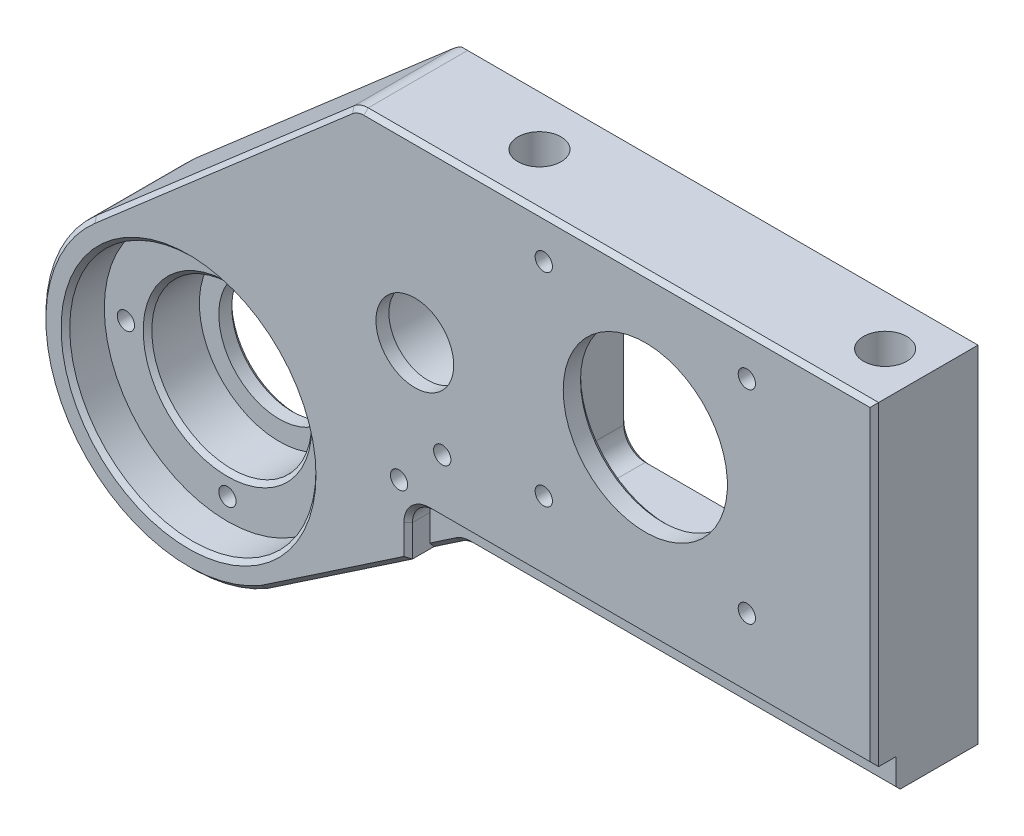
from build123d import *

# Parameters (mm, degrees)
EXTRUDE_1_DEPTH              = 25
SKETCH_2_W                   = 58
SKETCH_2_H                   = 58
CUT_EXTRUDE_1_DEPTH          = 20
SKETCH_3_R                   = 19
CUT_EXTRUDE_2_DEPTH          = 164.910721295
HOLE_WIZARD_M4_1_D           = 3.3
HOLE_WIZARD_M4_1_DEPTH       = 10.1
HOLE_WIZARD_M4_1_CBORE_D     = 4
HOLE_WIZARD_M4_1_CBORE_DEPTH = 8
HOLE_WIZARD_M4_1_TIP         = 0.991420021
CUT_EXTRUDE_3_DEPTH          = 5
SKETCH_10_R                  = 14
CUT_EXTRUDE_7_DEPTH          = 165.595639539
SKETCH_11_R                  = 18.5
CUT_EXTRUDE_8_DEPTH          = 21
SKETCH_12_R                  = 28.5
CUT_EXTRUDE_9_DEPTH          = 9
M10X1_25_1_D                 = 8.8
M10X1_25_1_DEPTH             = 33.75
M10X1_25_1_CBORE_D           = 10
M10X1_25_1_CBORE_DEPTH       = 30
M10X1_25_1_TIP               = 2.643786724
HOLE_WIZARD_M4_2_D           = 3.3
HOLE_WIZARD_M4_2_DEPTH       = 10.1
HOLE_WIZARD_M4_2_CBORE_D     = 4
HOLE_WIZARD_M4_2_CBORE_DEPTH = 8
HOLE_WIZARD_M4_2_TIP         = 0.991420021
M10X1_25_2_D                 = 8.8
M10X1_25_2_DEPTH             = 23.75
M10X1_25_2_CBORE_D           = 10
M10X1_25_2_CBORE_DEPTH       = 20
M10X1_25_2_TIP               = 2.643786724
HOLE_WIZARD_M4_3_D           = 3.3
HOLE_WIZARD_M4_3_DEPTH       = 10.1
HOLE_WIZARD_M4_3_CBORE_D     = 4
HOLE_WIZARD_M4_3_CBORE_DEPTH = 8
HOLE_WIZARD_M4_3_TIP         = 0.991420021
FILLET_1_R                   = 5
FILLET_2_R                   = 5
FILLET_3_R                   = 5
CHAMFER_1_SIZE               = 1
CHAMFER_2_SIZE               = 1
CHAMFER_3_SIZE               = 1
FILLET_5_R                   = 5
FILLET_7_R                   = 5
CHAMFER_4_SIZE               = 1
CHAMFER_5_SIZE               = 1
CHAMFER_6_SIZE               = 1
CHAMFER_7_SIZE               = 1
CHAMFER_8_SIZE               = 1
HOLE_WIZARD_M3_1_D           = 2.5
HOLE_WIZARD_M3_1_DEPTH       = 7.5
HOLE_WIZARD_M3_1_CBORE_D     = 3
HOLE_WIZARD_M3_1_CBORE_DEPTH = 6
HOLE_WIZARD_M3_1_TIP         = 0.751075774
SKETCH_27_R                  = 1.05
CUT_EXTRUDE_10_DEPTH         = 5
SKETCH_28_R                  = 9
CUT_EXTRUDE_11_DEPTH         = 165.595639539
SKETCH_30_R                  = 12.01
CUT_EXTRUDE_12_DEPTH         = 22
CUT_EXTRUDE_13_DEPTH         = 6
FILLET_8_R                   = 6
FILLET_9_R                   = 6
FILLET_10_R                  = 6
FILLET_11_R                  = 6
HOLE_WIZARD_M3_2_D           = 2.5
HOLE_WIZARD_M3_2_DEPTH       = 7.5
HOLE_WIZARD_M3_2_CBORE_D     = 3
HOLE_WIZARD_M3_2_CBORE_DEPTH = 6
HOLE_WIZARD_M3_2_TIP         = 0.751075774
SKETCH_34_W                  = 110.999205056
SKETCH_34_H                  = 23.357770551
CUT_EXTRUDE_14_DEPTH         = 1
HOLE_WIZARD_M4_4_D           = 3.3
HOLE_WIZARD_M4_4_DEPTH       = 10.1
HOLE_WIZARD_M4_4_CBORE_D     = 4
HOLE_WIZARD_M4_4_CBORE_DEPTH = 8
HOLE_WIZARD_M4_4_TIP         = 0.991420021


# Some blends are built 0.0001 mm under size
with BuildPart() as part:
    # 草图1 → 拉伸1 (new body)
    with BuildSketch(Plane.XY):
        with BuildLine():
            Line((110.103016241, 97.672563805), (10.103016241, 97.672563805))
            Line((10.103016241, 97.672563805), (-50.926931526, 44.657993575))
            ThreePointArc((-50.926931526, 44.657993575), (-56.221019531, -0.904930399), (-11.32784203, -10.318220087))
            Line((-11.32784203, -10.318220087), (30.103016241, 17.672563805))
            Line((30.103016241, 17.672563805), (110.103016241, 17.672563805))
            Line((110.103016241, 17.672563805), (130.103016241, 17.672563805))
            Line((130.103016241, 17.672563805), (130.103016241, 97.672563805))
            Line((130.103016241, 97.672563805), (110.103016241, 97.672563805))
        make_face()
    extrude(amount=EXTRUDE_1_DEPTH)

    # 草图2 → 切除-拉伸1 (cut)
    with BuildSketch(Plane(origin=(0, 0, 0), x_dir=(-1, 0, 0), z_dir=(0, 0, -1))):
        with Locations((-77.103016241, 64.672563805)):
            Rectangle(SKETCH_2_W, SKETCH_2_H)
    extrude(amount=-CUT_EXTRUDE_1_DEPTH, mode=Mode.SUBTRACT)

    # 草图3 → 切除-拉伸2 (cut, through all)
    with BuildSketch(Plane(origin=(0, 0, 20), x_dir=(-1, 0, 0), z_dir=(0, 0, -1))):
        with Locations((-77.103016241, 64.672563805)):
            Circle(SKETCH_3_R)
    extrude(amount=-CUT_EXTRUDE_2_DEPTH, mode=Mode.SUBTRACT)

    # M4 螺纹孔1
    with Locations(Plane(origin=(100.603016241, 88.172563805, 20), x_dir=(-1, 0, 0), z_dir=(0, 0, -1))):
        with Locations((0, 0), (47, 0), (0, -47), (47, -47)):
            CounterBoreHole(HOLE_WIZARD_M4_1_D / 2, HOLE_WIZARD_M4_1_CBORE_D / 2, HOLE_WIZARD_M4_1_CBORE_DEPTH, depth=HOLE_WIZARD_M4_1_DEPTH)
            with Locations((0, 0, -(HOLE_WIZARD_M4_1_DEPTH + HOLE_WIZARD_M4_1_TIP / 2))):  # 118° drill point
                Cone(0, HOLE_WIZARD_M4_1_D / 2, HOLE_WIZARD_M4_1_TIP, mode=Mode.SUBTRACT)

    # 草图6 → 切除-拉伸3 (cut)
    with BuildSketch(Plane.XY.offset(25)):
        Polygon((30.103016241, 24.672563805), (22.214984728, 24.672563805), (22.214984728, 12.343391429), (30.103016241, 17.672563805), (130.103016241, 17.672563805), (130.103016241, 24.672563805), align=None)
    extrude(amount=-CUT_EXTRUDE_3_DEPTH, mode=Mode.SUBTRACT)

    # 草图10 → 切除-拉伸7 (cut, through all)
    with BuildSketch(Plane.XY.offset(25)):
        with Locations((-28.61867045, 18.976902465)):
            Circle(SKETCH_10_R)
    extrude(amount=-CUT_EXTRUDE_7_DEPTH, mode=Mode.SUBTRACT)

    # 草图11 → 切除-拉伸8 (cut)
    with BuildSketch(Plane.XY.offset(25)):
        with Locations((-28.61867045, 18.976902465)):
            Circle(SKETCH_11_R)
    extrude(amount=-CUT_EXTRUDE_8_DEPTH, mode=Mode.SUBTRACT)

    # 草图12 → 切除-拉伸9 (cut)
    with BuildSketch(Plane.XY.offset(25)):
        with Locations((-28.61867045, 18.976902465)):
            Circle(SKETCH_12_R)
    extrude(amount=-CUT_EXTRUDE_9_DEPTH, mode=Mode.SUBTRACT)

    # M10x1.25 螺纹孔1
    with Locations(Plane.XZ.offset(-17.672563805)):
        with Locations((120.103016241, 10), (40.103016241, 10)):
            CounterBoreHole(M10X1_25_1_D / 2, M10X1_25_1_CBORE_D / 2, M10X1_25_1_CBORE_DEPTH, depth=M10X1_25_1_DEPTH)
            with Locations((0, 0, -(M10X1_25_1_DEPTH + M10X1_25_1_TIP / 2))):  # 118° drill point
                Cone(0, M10X1_25_1_D / 2, M10X1_25_1_TIP, mode=Mode.SUBTRACT)

    # M4 螺纹孔2
    with Locations(Plane.XY.offset(16)):
        with Locations((-28.61867045, 42.476902465), (-52.11892229, 18.976902465), (-5.11867045, 18.976902465), (-28.61867045, -4.523097535)):
            CounterBoreHole(HOLE_WIZARD_M4_2_D / 2, HOLE_WIZARD_M4_2_CBORE_D / 2, HOLE_WIZARD_M4_2_CBORE_DEPTH, depth=HOLE_WIZARD_M4_2_DEPTH)
            with Locations((0, 0, -(HOLE_WIZARD_M4_2_DEPTH + HOLE_WIZARD_M4_2_TIP / 2))):  # 118° drill point
                Cone(0, HOLE_WIZARD_M4_2_D / 2, HOLE_WIZARD_M4_2_TIP, mode=Mode.SUBTRACT)

    # M10x1.25 螺纹孔2
    with Locations(Plane(origin=(0, 97.672563805, 0), x_dir=(-1, 0, 0), z_dir=(0, 1, 0))):
        with Locations((-40.103016241, 12.5), (-120.103016241, 12.5)):
            CounterBoreHole(M10X1_25_2_D / 2, M10X1_25_2_CBORE_D / 2, M10X1_25_2_CBORE_DEPTH, depth=M10X1_25_2_DEPTH)
            with Locations((0, 0, -(M10X1_25_2_DEPTH + M10X1_25_2_TIP / 2))):  # 118° drill point
                Cone(0, M10X1_25_2_D / 2, M10X1_25_2_TIP, mode=Mode.SUBTRACT)

    # M4 螺纹孔3
    with Locations(Plane.XY.offset(25)):
        with Locations((30.103016241, 37.672563805), (20.103016241, 27.672563805)):
            CounterBoreHole(HOLE_WIZARD_M4_3_D / 2, HOLE_WIZARD_M4_3_CBORE_D / 2, HOLE_WIZARD_M4_3_CBORE_DEPTH, depth=HOLE_WIZARD_M4_3_DEPTH)
            with Locations((0, 0, -(HOLE_WIZARD_M4_3_DEPTH + HOLE_WIZARD_M4_3_TIP / 2))):  # 118° drill point
                Cone(0, HOLE_WIZARD_M4_3_D / 2, HOLE_WIZARD_M4_3_TIP, mode=Mode.SUBTRACT)

    # 圆角1
    fillet_1_edges = [part.edges().sort_by_distance(p)[0] for p in [
        (48.103016241, 35.672563805, 10),
    ]]
    fillet(fillet_1_edges, radius=FILLET_1_R)

    # 圆角2
    fillet_2_edges = [part.edges().sort_by_distance(p)[0] for p in [
        (106.103016241, 35.672563805, 10),
        (106.103016241, 93.672563805, 10),
        (48.103016241, 93.672563805, 10),
    ]]
    fillet(fillet_2_edges, radius=FILLET_2_R)

    # 圆角3
    fillet_3_edges = [part.edges().sort_by_distance(p)[0] for p in [
        (22.214984728, 24.672563805, 22.5),
    ]]
    fillet(fillet_3_edges, radius=FILLET_3_R)

    # 倒角1
    chamfer_1_edges = [part.edges().sort_by_distance(p)[0] for p in [
        (96.103016241, 64.672563805, 20),
    ]]
    chamfer(chamfer_1_edges, length=CHAMFER_1_SIZE)

    # 倒角2
    # the kernel refuses this chamfer: 1 mm, written as the material it takes off along each edge
    with BuildSketch(Plane(origin=(-28.61867045, 18.976902465, 16), x_dir=(1, 0, 0), z_dir=(0, -1, 0))) as chamfer_2_piece_1:
        Polygon((18.5 + CHAMFER_2_SIZE, 0), (18.5, -CHAMFER_2_SIZE), (18.5, 0), align=None)
    revolve(axis=Axis((-28.61867045, 18.976902465, 16), (0, 0, 1)), mode=Mode.SUBTRACT)
    with BuildSketch(Plane(origin=(48.103016241, 88.672563805, 0), x_dir=(0, 0, 1), z_dir=(0, -1, 0)), Plane(origin=(101.103016241, 93.672563805, 0), x_dir=(0, 0, 1), z_dir=(-1, 0, 0)), Plane(origin=(53.103016241, 35.672563805, 0), x_dir=(0, 0, 1), z_dir=(1, 0, 0)), Plane(origin=(106.103016241, 40.672563805, 0), x_dir=(0, 0, 1), z_dir=(0, 1, 0))) as chamfer_2_piece_2:
        Polygon((CHAMFER_2_SIZE, 0), (0, CHAMFER_2_SIZE), (0, 0), align=None)
    extrude(amount=48, mode=Mode.SUBTRACT)
    with BuildSketch(Plane(origin=(53.103016241, 40.672563805, 0), x_dir=(-1, 0, 0), z_dir=(0, 1, 0))) as chamfer_2_piece_3:
        Polygon((5, CHAMFER_2_SIZE), (5 + CHAMFER_2_SIZE, 0), (5, 0), align=None)
    revolve(axis=Axis((53.103016241, 40.672563805, 0), (0, 0, 1)), revolution_arc=90, mode=Mode.SUBTRACT)
    with BuildSketch(Plane(origin=(53.103016241, 88.672563805, 0), x_dir=(-1, 0, 0), z_dir=(0, -1, 0))) as chamfer_2_piece_4:
        Polygon((5, -CHAMFER_2_SIZE), (5 + CHAMFER_2_SIZE, 0), (5, 0), align=None)
    revolve(axis=Axis((53.103016241, 88.672563805, 0), (0, 0, -1)), revolution_arc=90, mode=Mode.SUBTRACT)
    with BuildSketch(Plane(origin=(101.103016241, 40.672563805, 0), x_dir=(0, -1, 0), z_dir=(-1, 0, 0))) as chamfer_2_piece_5:
        Polygon((5, CHAMFER_2_SIZE), (5 + CHAMFER_2_SIZE, 0), (5, 0), align=None)
    revolve(axis=Axis((101.103016241, 40.672563805, 0), (0, 0, 1)), revolution_arc=90, mode=Mode.SUBTRACT)
    with BuildSketch(Plane(origin=(101.103016241, 88.672563805, 0), x_dir=(0, 1, 0), z_dir=(-1, 0, 0))) as chamfer_2_piece_6:
        Polygon((5, -CHAMFER_2_SIZE), (5 + CHAMFER_2_SIZE, 0), (5, 0), align=None)
    revolve(axis=Axis((101.103016241, 88.672563805, 0), (0, 0, -1)), revolution_arc=90, mode=Mode.SUBTRACT)
    with BuildSketch(Plane(origin=(132.674699229, 97.672563805, 0), x_dir=(0, 0, 1), z_dir=(-1, 0, 0))) as chamfer_2_piece_7:
        Polygon((CHAMFER_2_SIZE, 0), (0, -CHAMFER_2_SIZE), (0, 0), align=None)
    extrude(amount=125.143365976, mode=Mode.SUBTRACT)
    with BuildSketch(Plane(origin=(130.103016241, 15.100880817, 0), x_dir=(0, 0, 1), z_dir=(0, 1, 0))) as chamfer_2_piece_8:
        Polygon((CHAMFER_2_SIZE, 0), (0, -CHAMFER_2_SIZE), (0, 0), align=None)
    extrude(amount=85.143365976, mode=Mode.SUBTRACT)
    with BuildSketch(Plane(origin=(27.531333253, 17.672563805, 0), x_dir=(0, 1, 0), z_dir=(1, 0, 0))) as chamfer_2_piece_9_section:
        Polygon((CHAMFER_2_SIZE, 0), (0, CHAMFER_2_SIZE), (0, 0), align=None)
    chamfer_2_piece_9 = extrude(amount=105.143365976, mode=Mode.PRIVATE)
    chamfer_2_piece_9 = split(chamfer_2_piece_9, bisect_by=Plane(origin=(28.337282225, 16.479629811, 0), z_dir=(0.5598156778483901, -0.8286171654239053, 0)), keep=Keep.TOP, mode=Mode.PRIVATE)
    add(chamfer_2_piece_9, mode=Mode.SUBTRACT)
    with BuildSketch(Plane(origin=(-17.720664033, -14.637225453, 0), x_dir=(0, 0, 1), z_dir=(0.8286171654239053, 0.5598156778483901, 0))) as chamfer_2_piece_10_section:
        Polygon((CHAMFER_2_SIZE, 0), (0, -CHAMFER_2_SIZE), (0, 0), align=None)
    chamfer_2_piece_10 = extrude(amount=60.286731952, mode=Mode.PRIVATE)
    chamfer_2_piece_10 = split(chamfer_2_piece_10, bisect_by=Plane(origin=(-17.720664033, 17.672563805, 0), z_dir=(0, -1, 0)), keep=Keep.TOP, mode=Mode.PRIVATE)
    add(chamfer_2_piece_10, mode=Mode.SUBTRACT)
    with BuildSketch(Plane(origin=(-28.61867045, 18.976902465, 0), x_dir=(-0.6557915716976678, 0.7549419941229278, 0), z_dir=(0.7549419941229278, 0.6557915716976678, 0))) as chamfer_2_piece_11:
        Polygon((34.017303727, CHAMFER_2_SIZE), (34.017303727 - CHAMFER_2_SIZE, 0), (34.017303727, 0), align=None)
    revolve(axis=Axis((-28.61867045, 18.976902465, 0), (0, 0, 1)), revolution_arc=173.90833447, mode=Mode.SUBTRACT)
    with BuildSketch(Plane(origin=(-28.61867045, 18.976902465, 0), x_dir=(1, 0, 0), z_dir=(0, -1, 0))) as chamfer_2_piece_12:
        Polygon((14 + CHAMFER_2_SIZE, 0), (14, CHAMFER_2_SIZE), (14, 0), align=None)
    revolve(axis=Axis((-28.61867045, 18.976902465, 0), (0, 0, 1)), mode=Mode.SUBTRACT)
    with BuildSketch(Plane(origin=(12.044487724, 99.359051834, 0), x_dir=(0, 0, 1), z_dir=(-0.7549419941229278, -0.6557915716976678, 0))) as chamfer_2_piece_13:
        Polygon((CHAMFER_2_SIZE, 0), (0, -CHAMFER_2_SIZE), (0, 0), align=None)
    extrude(amount=83.412261791, mode=Mode.SUBTRACT)
    with BuildSketch(Plane(origin=(-17.720664033, -14.637225453, 0), x_dir=(0, 0, 1), z_dir=(0.8286171654239053, 0.5598156778483901, 0))) as chamfer_2_piece_14a_section:
        Polygon((CHAMFER_2_SIZE, 0), (0, -CHAMFER_2_SIZE), (0, 0), align=None)
    chamfer_2_piece_14a = extrude(amount=60.286731952, mode=Mode.PRIVATE)
    chamfer_2_piece_14a = split(chamfer_2_piece_14a, bisect_by=Plane(origin=(-17.720664033, 17.672563805, 0), z_dir=(0, 1, 0)), keep=Keep.TOP, mode=Mode.PRIVATE)
    with BuildSketch(Plane(origin=(27.531333253, 17.672563805, 0), x_dir=(0, 1, 0), z_dir=(1, 0, 0))) as chamfer_2_piece_14b_section:
        Polygon((CHAMFER_2_SIZE, 0), (0, CHAMFER_2_SIZE), (0, 0), align=None)
    chamfer_2_piece_14b = extrude(amount=105.143365976, mode=Mode.PRIVATE)
    chamfer_2_piece_14b = split(chamfer_2_piece_14b, bisect_by=Plane(origin=(28.337282225, 16.479629811, 0), z_dir=(-0.5598156778483901, 0.8286171654239053, 0)), keep=Keep.TOP, mode=Mode.PRIVATE)
    chamfer_2_piece_14 = chamfer_2_piece_14a & chamfer_2_piece_14b
    add(chamfer_2_piece_14, mode=Mode.SUBTRACT)

    # 倒角3
    chamfer_3_edges = [part.edges().sort_by_distance(p)[0] for p in [
        (-57.11867045, 18.976902465, 25),
    ]]
    chamfer(chamfer_3_edges, length=CHAMFER_3_SIZE)

    # 圆角5
    fillet_5_edges = [part.edges().sort_by_distance(p)[0] for p in [
        (10.103016241, 97.672563805, 13),
    ]]
    fillet(fillet_5_edges, radius=FILLET_5_R)

    # 圆角7
    fillet_7_edges = [part.edges().sort_by_distance(p)[0] for p in [
        (30.103016241, 17.672563805, 10.5),
    ]]
    fillet(fillet_7_edges, radius=FILLET_7_R)

    # 倒角4
    chamfer_4_edges = [part.edges().sort_by_distance(p)[0] for p in [
        (80.868370095, 17.672563805, 20),
        (30.170069129, 17.453538033, 20),
        (25.524815144, 14.57952053, 20),
    ]]
    chamfer(chamfer_4_edges, length=CHAMFER_4_SIZE)

    # 倒角5
    chamfer_5_edges = [part.edges().sort_by_distance(p)[0] for p in [
        (130.103016241, 61.172563805, 25),
    ]]
    chamfer(chamfer_5_edges, length=CHAMFER_5_SIZE)

    # 倒角6
    chamfer_6_edges = [part.edges().sort_by_distance(p)[0] for p in [
        (22.214984728, 16.007977617, 25),
        (23.679450822, 23.208097711, 25),
        (78.159000485, 24.672563805, 25),
    ]]
    chamfer(chamfer_6_edges, length=CHAMFER_6_SIZE)

    # 倒角7
    # the kernel refuses this chamfer: 1 mm, written as the material it takes off along each edge
    with BuildSketch(Plane(origin=(8.692472193, 96.447273776, 25), x_dir=(0.6557915716976678, -0.7549419941229278, 0), z_dir=(-0.7549419941229278, -0.6557915716976678, 0))) as chamfer_7_piece_1:
        Polygon((CHAMFER_7_SIZE, 0), (0, -CHAMFER_7_SIZE), (0, 0), align=None)
    extrude(amount=91.830579932, mode=Mode.SUBTRACT)
    with BuildSketch(Plane(origin=(11.971430052, 97.672563805, 25), x_dir=(0, -1, 0), z_dir=(1, 0, 0))) as chamfer_7_piece_2:
        Polygon((CHAMFER_7_SIZE, 0), (0, CHAMFER_7_SIZE), (0, 0), align=None)
    extrude(amount=119.703269177, mode=Mode.SUBTRACT)
    with BuildSketch(Plane(origin=(11.971430052, 92.672563805, 25), x_dir=(0, 1, 0), z_dir=(1, 0, 0))) as chamfer_7_piece_3:
        Polygon((5 - CHAMFER_7_SIZE, 0), (5, -CHAMFER_7_SIZE), (5, 0), align=None)
    revolve(axis=Axis((11.971430052, 92.672563805, 25), (0, 0, 1)), revolution_arc=40.979698396, mode=Mode.SUBTRACT)

    # 倒角8
    chamfer_8_edges = [part.edges().sort_by_distance(p)[0] for p in [
        (-53.607000292, -4.104698964, 25),
    ]]
    chamfer(chamfer_8_edges, length=CHAMFER_8_SIZE - 0.0001)  # a hair under: the kernel refuses the full size

    # M3 螺纹孔1
    with Locations(Plane(origin=(-4.930593281, 51.85736779, 0), x_dir=(-1, 0, 0), z_dir=(0, 0, -1))):
        with Locations((0, 0)):
            CounterBoreHole(HOLE_WIZARD_M3_1_D / 2, HOLE_WIZARD_M3_1_CBORE_D / 2, HOLE_WIZARD_M3_1_CBORE_DEPTH, depth=HOLE_WIZARD_M3_1_DEPTH)
            with Locations((0, 0, -(HOLE_WIZARD_M3_1_DEPTH + HOLE_WIZARD_M3_1_TIP / 2))):  # 118° drill point
                Cone(0, HOLE_WIZARD_M3_1_D / 2, HOLE_WIZARD_M3_1_TIP, mode=Mode.SUBTRACT)

    # 草图27 → 切除-拉伸10 (cut)
    with BuildSketch(Plane(origin=(0, 0, 0), x_dir=(-1, 0, 0), z_dir=(0, 0, -1))):
        with Locations((11.36526499, 36.230307926)):
            Circle(SKETCH_27_R)
    extrude(amount=-CUT_EXTRUDE_10_DEPTH, mode=Mode.SUBTRACT)

    # 草图28 → 切除-拉伸11 (cut, through all)
    with BuildSketch(Plane.XY.offset(25)):
        with Locations((23.757443728, 56.96153967)):
            Circle(SKETCH_28_R)
    extrude(amount=-CUT_EXTRUDE_11_DEPTH, mode=Mode.SUBTRACT)

    # 草图30 → 切除-拉伸12 (cut)
    with BuildSketch(Plane(origin=(0, 0, 0), x_dir=(-1, 0, 0), z_dir=(0, 0, -1))):
        with Locations((-23.757443728, 56.96153967)):
            Circle(SKETCH_30_R)
    extrude(amount=-CUT_EXTRUDE_12_DEPTH, mode=Mode.SUBTRACT)

    # 草图31 → 切除-拉伸13 (cut)
    with BuildSketch(Plane(origin=(0, 0, 0), x_dir=(-1, 0, 0), z_dir=(0, 0, -1))):
        with BuildLine():
            Line((-10.757443728, 41.762855516), (-10.757443728, 72.160223823))
            ThreePointArc((-10.757443728, 72.160223823), (-23.757443728, 76.96153967), (-36.757443728, 72.160223823))
            Line((-36.757443728, 72.160223823), (-36.757443728, 41.762855516))
            ThreePointArc((-36.757443728, 41.762855516), (-23.757443728, 36.96153967), (-10.757443728, 41.762855516))
        make_face()
    extrude(amount=-CUT_EXTRUDE_13_DEPTH, mode=Mode.SUBTRACT)

    # 圆角8
    fillet_8_edges = [part.edges().sort_by_distance(p)[0] for p in [
        (10.757443728, 72.160223823, 3),
    ]]
    fillet(fillet_8_edges, radius=FILLET_8_R)

    # 圆角9
    fillet_9_edges = [part.edges().sort_by_distance(p)[0] for p in [
        (36.757443728, 72.160223823, 3),
    ]]
    fillet(fillet_9_edges, radius=FILLET_9_R)

    # 圆角10
    fillet_10_edges = [part.edges().sort_by_distance(p)[0] for p in [
        (36.757443728, 41.762855516, 3),
    ]]
    fillet(fillet_10_edges, radius=FILLET_10_R)

    # 圆角11
    fillet_11_edges = [part.edges().sort_by_distance(p)[0] for p in [
        (10.757443728, 41.762855516, 3),
    ]]
    fillet(fillet_11_edges, radius=FILLET_11_R)

    # M3 螺纹孔2
    with Locations(Plane(origin=(14.115629583, 68.452206317, 6), x_dir=(-1, 0, 0), z_dir=(0, 0, -1))):
        with Locations((0, 0), (-9.641814145, 3.509333353), (-19.28362829, 0), (-19.28362829, -22.981333294), (-9.641814145, -26.490666647), (0, -22.981333294)):
            CounterBoreHole(HOLE_WIZARD_M3_2_D / 2, HOLE_WIZARD_M3_2_CBORE_D / 2, HOLE_WIZARD_M3_2_CBORE_DEPTH, depth=HOLE_WIZARD_M3_2_DEPTH)
            with Locations((0, 0, -(HOLE_WIZARD_M3_2_DEPTH + HOLE_WIZARD_M3_2_TIP / 2))):  # 118° drill point
                Cone(0, HOLE_WIZARD_M3_2_D / 2, HOLE_WIZARD_M3_2_TIP, mode=Mode.SUBTRACT)

    # 草图34 → 切除-拉伸14 (cut)
    with BuildSketch(Plane(origin=(0, 0, 0), x_dir=(-1, 0, 0), z_dir=(0, 0, -1))):
        with Locations((7.245391824, -13.006321471)):
            Rectangle(SKETCH_34_W, SKETCH_34_H)
    extrude(amount=-CUT_EXTRUDE_14_DEPTH, mode=Mode.SUBTRACT)

    # M4 螺纹孔4
    with Locations(Plane(origin=(-28.61867045, -9.023097535, 1), x_dir=(-1, 0, 0), z_dir=(0, 0, -1))):
        with Locations((0, 0)):
            CounterBoreHole(HOLE_WIZARD_M4_4_D / 2, HOLE_WIZARD_M4_4_CBORE_D / 2, HOLE_WIZARD_M4_4_CBORE_DEPTH, depth=HOLE_WIZARD_M4_4_DEPTH)
            with Locations((0, 0, -(HOLE_WIZARD_M4_4_DEPTH + HOLE_WIZARD_M4_4_TIP / 2))):  # 118° drill point
                Cone(0, HOLE_WIZARD_M4_4_D / 2, HOLE_WIZARD_M4_4_TIP, mode=Mode.SUBTRACT)


solid = part.part
